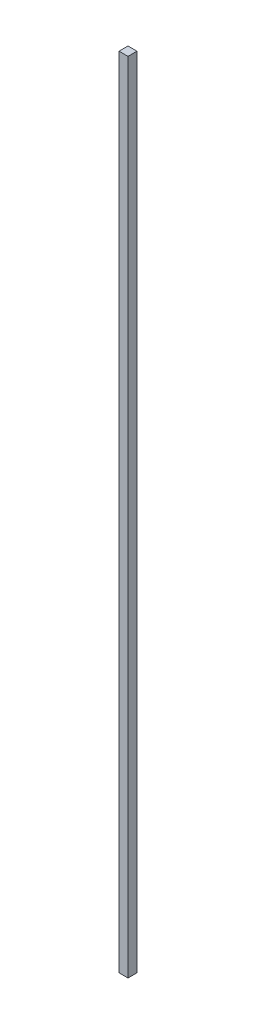
from build123d import *

# Parameters (mm, degrees)
SKETCH1_W           = 25.4
SKETCH1_H           = 25.4
BOSS_EXTRUDE1_DEPTH = 2260.6


with BuildPart() as part:
    # Sketch1 → Boss-Extrude1 (new body)
    with BuildSketch(Plane(origin=(0, 0, 0), x_dir=(1, 0, 0), z_dir=(0, 1, 0))):
        with Locations((12.7, 12.7)):
            Rectangle(SKETCH1_W, SKETCH1_H)
    extrude(amount=BOSS_EXTRUDE1_DEPTH)


solid = part.part
